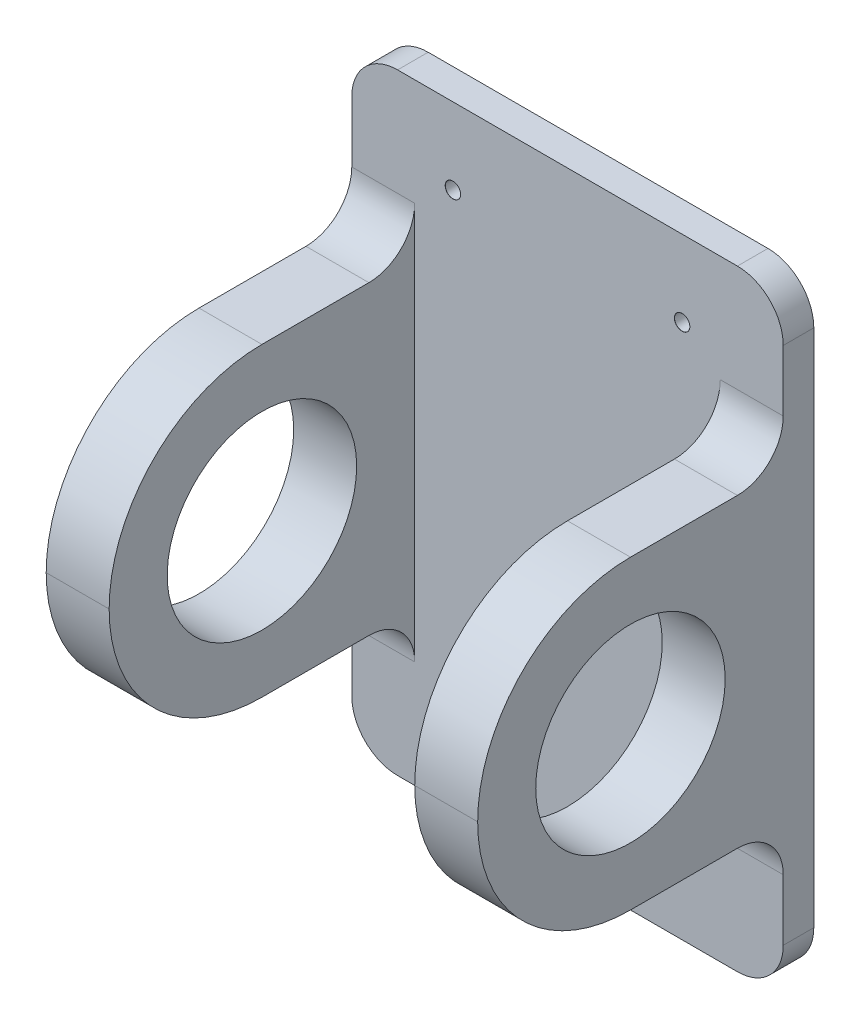
from build123d import *

# Parameters (mm, degrees)
SKETCH1_W                       = 200
SKETCH1_H                       = 141.2
BOSS_EXTRUDE1_DEPTH             = 10
SKETCH2_W                       = 100
SKETCH2_H                       = 20.6
BOSS_EXTRUDE2_DEPTH             = 100
FILLET1_R                       = 50
F_10_0MM_DOWEL_HOLE1_D          = 62
F_5_0MM_DOWEL_HOLE1_D           = 5
F_5_0MM_DOWEL_HOLE1_CSINK_D     = 5.05
F_5_0MM_DOWEL_HOLE1_CSINK_ANGLE = 90
FILLET2_R                       = 15


with BuildPart() as part:
    # Sketch1 → Boss-Extrude1 (new body)
    with BuildSketch(Plane(origin=(0, 0, 0), x_dir=(0, 1, 0), z_dir=(0, 0, 1))):
        Rectangle(SKETCH1_W, SKETCH1_H)
    extrude(amount=-BOSS_EXTRUDE1_DEPTH)

    # Sketch2 → Boss-Extrude2 (add)
    with BuildSketch(Plane(origin=(0, 0, 0), x_dir=(0, 1, 0), z_dir=(0, 0, 1))):
        with Locations((0, 60.3)):
            Rectangle(SKETCH2_W, SKETCH2_H)
        with Locations((0, -60.3)):
            Rectangle(SKETCH2_W, SKETCH2_H)
    extrude(amount=BOSS_EXTRUDE2_DEPTH)

    # Fillet1
    fillet1_edges = [part.edges().sort_by_distance(p)[0] for p in [
        (60.3, 50, 100),
        (60.3, -50, 100),
        (-60.3, 50, 100),
        (-60.3, -50, 100),
    ]]
    fillet(fillet1_edges, radius=FILLET1_R - 0.0001)  # a hair under: the kernel refuses the full size

    # Ø10.0mm Dowel Hole1 (through all)
    with Locations(Plane.YZ.offset(70.6)):
        with Locations((0, 50)):
            Hole(F_10_0MM_DOWEL_HOLE1_D / 2)

    # Ø5.0mm Dowel Hole1 (through all)
    with Locations(Plane(origin=(0, 0, 0), x_dir=(0, 1, 0), z_dir=(0, 0, 1))):
        with Locations((75, -37.5), (-75, 37.5), (-75, -37.5), (75, 37.5)):
            CounterSinkHole(F_5_0MM_DOWEL_HOLE1_D / 2, F_5_0MM_DOWEL_HOLE1_CSINK_D / 2, counter_sink_angle=F_5_0MM_DOWEL_HOLE1_CSINK_ANGLE)

    # Fillet2
    fillet2_edges = [part.edges().sort_by_distance(p)[0] for p in [
        (-60.3, -50, 0),
        (-60.3, 50, 0),
        (60.3, -50, 0),
        (60.3, 50, 0),
        (-70.6, -100, -5),
        (-70.6, 100, -5),
        (70.6, 100, -5),
        (70.6, -100, -5),
    ]]
    fillet(fillet2_edges, radius=FILLET2_R)


solid = part.part
